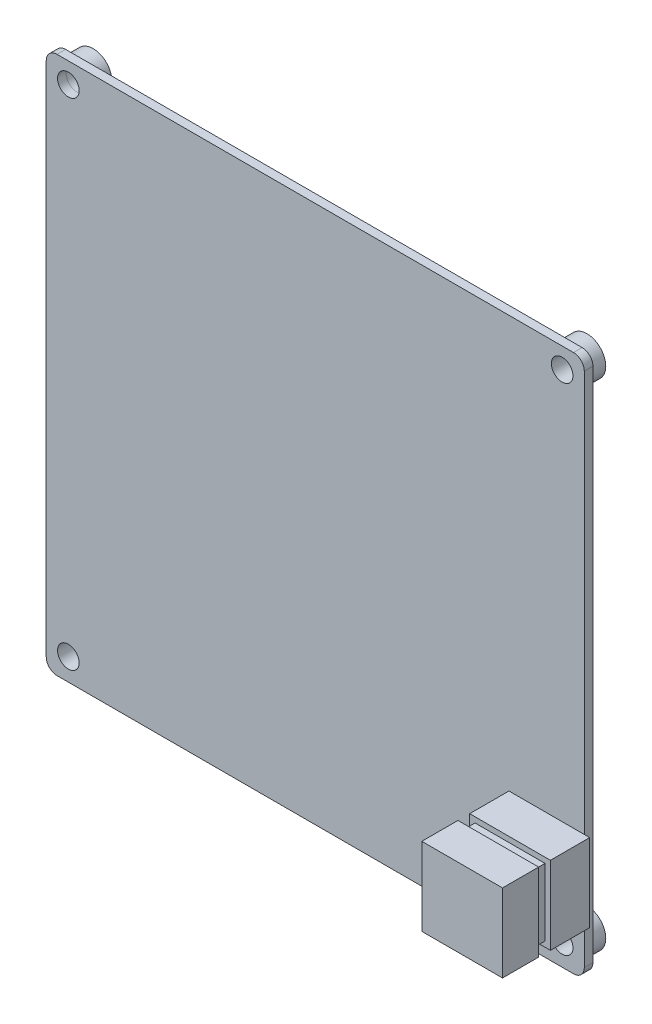
from build123d import *

# Parameters (mm, degrees)
SKETCH_2_R           = 2.0065
EXTRUDE_1_DEPTH      = 1.6
EXTRUDE_2_DEPTH      = 1
EXTRUDE_2_DEPTH_BACK = 14
SKETCH_3_W           = 6.72
SKETCH_3_H           = 14.5
SKETCH_4_W           = 2.18
SKETCH_4_H           = 12.5
EXTRUDE_3_DEPTH      = 13
SKETCH_5_R           = 3.5
SKETCH_5_R_2         = 2.0065
SKETCH_5_R_3         = 2.007340555
EXTRUDE_4_DEPTH      = 3


with BuildPart() as part:
    # 草图2 → 凸台-拉伸1 (new body)
    with BuildSketch(Plane.XY):
        with BuildLine():
            Line((-50, -48), (-50, 48))
            ThreePointArc((-50, 48), (-49.414213562, 49.414213562), (-48, 50))
            Line((-48, 50), (48, 50))
            ThreePointArc((48, 50), (49.414213562, 49.414213562), (50, 48))
            Line((50, 48), (50, -48))
            ThreePointArc((50, -48), (49.414213562, -49.414213562), (48, -50))
            Line((48, -50), (-48, -50))
            ThreePointArc((-48, -50), (-49.414213562, -49.414213562), (-50, -48))
        make_face()
        with Locations((-45.89, -45.89)):
            Circle(SKETCH_2_R, mode=Mode.SUBTRACT)
        with Locations((45.89, -45.89)):
            Circle(SKETCH_2_R, mode=Mode.SUBTRACT)
        with Locations((-45.89, 46.19)):
            Circle(SKETCH_2_R, mode=Mode.SUBTRACT)
        with Locations((45.89, 46.19)):
            Circle(SKETCH_2_R, mode=Mode.SUBTRACT)
    extrude(amount=EXTRUDE_1_DEPTH)

    # 草图3 → 凸台-拉伸2 (add, two sides: drawn at the far end of the back side and taken through both)
    with BuildSketch(Plane(origin=(50, 0, 0), x_dir=(0, 0, -1), z_dir=(1, 0, 0)).offset(-EXTRUDE_2_DEPTH_BACK)):
        Polygon((-8.9, -33.82), (-8.9, -26.57), (-1.6, -26.57), (-1.6, -41.07), (-8.9, -41.07), align=None)
        with Locations((-14.44, -33.82)):
            Rectangle(SKETCH_3_W, SKETCH_3_H)
    extrude(amount=EXTRUDE_2_DEPTH + EXTRUDE_2_DEPTH_BACK)


with BuildPart() as extrude_2_piece_1:
    # of the separate pieces the step leaves, piece 1, a body of its own (extrude_2_pieces)
    add(part.part.solids().sort_by_distance((-50, -48, 0))[0])



with BuildPart() as extrude_2_piece_2:
    # of the separate pieces the step leaves, piece 2, a body of its own (extrude_2_pieces)
    add(part.part.solids().sort_by_distance((51, -26.57, 11.08))[0])


with BuildPart() as extrude_2_piece_1_1:
    add(extrude_2_piece_1.part)

    add(extrude_2_piece_2.part)  # 凸台-拉伸3 merges 凸台-拉伸2 piece 2
    # 草图4 → 凸台-拉伸3 (add)
    with BuildSketch(Plane(origin=(50, 0, 0), x_dir=(0, 0, -1), z_dir=(1, 0, 0))):
        with Locations((-9.99, -33.82)):
            Rectangle(SKETCH_4_W, SKETCH_4_H)
    extrude(amount=-EXTRUDE_3_DEPTH)

    # 草图5 → 凸台-拉伸4 (add)
    # profile 1 of 4: a face of its own
    with BuildSketch(Plane.XY):
        with Locations((-45.89, -45.89)):
            Circle(SKETCH_5_R)
        with Locations((-45.89, -45.89)):
            Circle(SKETCH_5_R_2, mode=Mode.SUBTRACT)
    # profile 2 of 4: a face of its own
    with BuildSketch(Plane.XY):
        with Locations((-45.89, 46.19)):
            Circle(SKETCH_5_R)
        with Locations((-45.89, 46.19)):
            Circle(SKETCH_5_R_3, mode=Mode.SUBTRACT)
    # profile 3 of 4: a face of its own
    with BuildSketch(Plane.XY):
        with Locations((45.89, 46.19)):
            Circle(SKETCH_5_R)
        with Locations((45.89, 46.19)):
            Circle(SKETCH_5_R_2, mode=Mode.SUBTRACT)
    # profile 4 of 4: a face of its own
    with BuildSketch(Plane.XY):
        with Locations((45.89, -45.89)):
            Circle(SKETCH_5_R)
        with Locations((45.89, -45.89)):
            Circle(SKETCH_5_R_2, mode=Mode.SUBTRACT)
    extrude(amount=-EXTRUDE_4_DEPTH)


solid = extrude_2_piece_1_1.part
